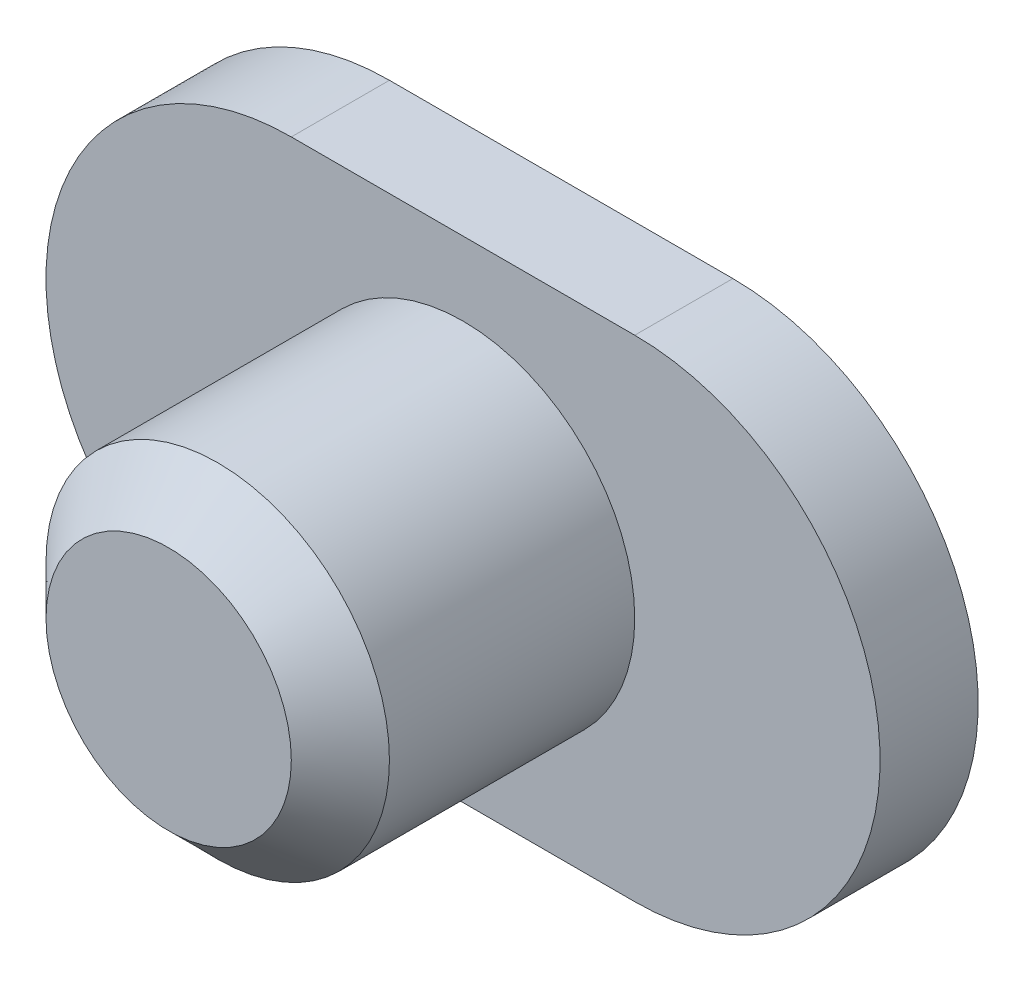
from build123d import *

# Parameters (mm, degrees)
EXTRUDE_1_DEPTH     = 2
SKETCH_2_R          = 3.5
EXTRUDE_2_DEPTH     = 6
CUT_EXTRUDE_1_DEPTH = 4
CHAMFER_1_SIZE      = 1


with BuildPart() as part:
    # Эскиз1 → Бобышка-Вытянуть1 (new body)
    with BuildSketch(Plane.XY):
        with BuildLine():
            Line((-3.5, 5), (3.5, 5))
            ThreePointArc((3.5, 5), (8.5, 0), (3.5, -5))
            Line((3.5, -5), (-3.5, -5))
            ThreePointArc((-3.5, -5), (-8.5, 0), (-3.5, 5))
        make_face()
    extrude(amount=EXTRUDE_1_DEPTH)

    # Эскиз2 → Бобышка-Вытянуть2 (add)
    with BuildSketch(Plane.XY.offset(2)):
        Circle(SKETCH_2_R)
    extrude(amount=EXTRUDE_2_DEPTH)

    # Эскиз3 → Вырез-Вытянуть1 (cut)
    with BuildSketch(Plane(origin=(0, 0, 0), x_dir=(-1, 0, 0), z_dir=(0, 0, -1))):
        with BuildLine():
            Line((0.75, -2), (-0.75, -2))
            ThreePointArc((-0.75, -2), (-2.75, 0), (-0.75, 2))
            Line((-0.75, 2), (0.75, 2))
            ThreePointArc((0.75, 2), (2.75, 0), (0.75, -2))
        make_face()
    extrude(amount=-CUT_EXTRUDE_1_DEPTH, mode=Mode.SUBTRACT)

    # Фаска1
    chamfer_1_edges = [part.edges().sort_by_distance(p)[0] for p in [
        (-3.5, 0, 8),
    ]]
    chamfer(chamfer_1_edges, length=CHAMFER_1_SIZE)


solid = part.part
